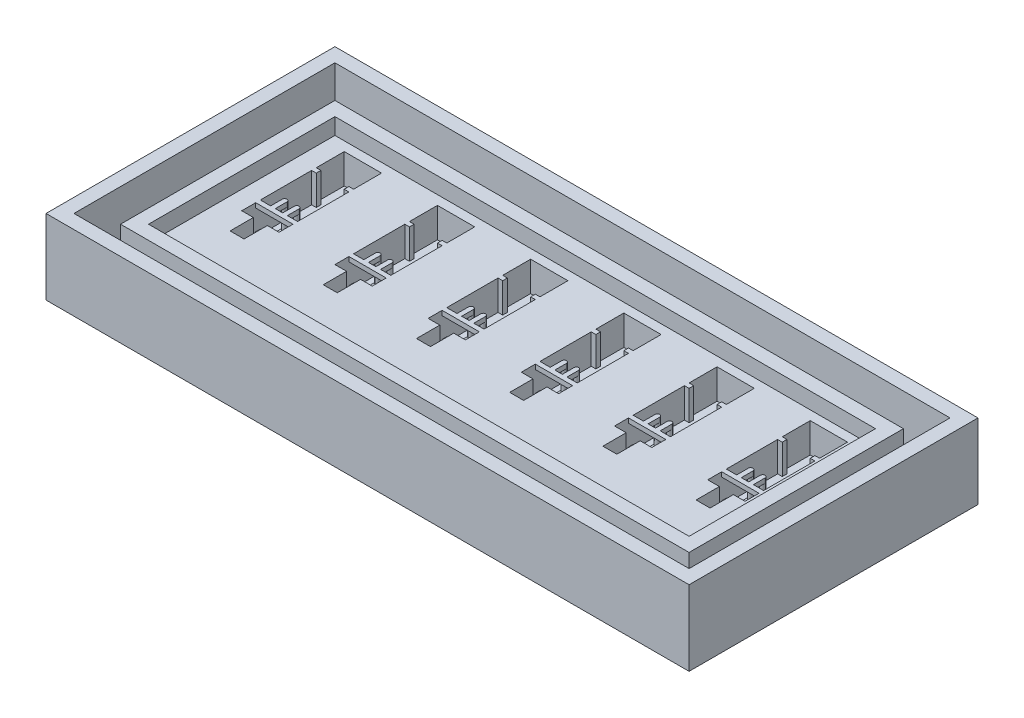
from build123d import *

# Parameters (mm, degrees)
SKETCH1_W            = 61
SKETCH1_H            = 23
BOSS_EXTRUDE1_DEPTH  = 6.05
SKETCH2_W            = 58
SKETCH2_H            = 20
CUT_EXTRUDE1_DEPTH   = 1.75
CUT_EXTRUDE3_DEPTH   = 3.2
SKETCH5_W            = 6
SKETCH5_H            = 1
CUT_EXTRUDE4_DEPTH   = 0.5
SKETCH10_W           = 4
SKETCH10_H           = 0.5
BOSS_EXTRUDE3_DEPTH  = 0.5
SKETCH11_W           = 4
SKETCH11_H           = 0.5
BOSS_EXTRUDE4_DEPTH  = 0.5
SKETCH9_R            = 0.25
SKETCH9_W            = 0.5
SKETCH9_H            = 1.25
BOSS_EXTRUDE5_DEPTH  = 0.5
BOSS_EXTRUDE6_START  = -0.5
BOSS_EXTRUDE6_DEPTH  = 0.5
BOSS_EXTRUDE7_REACH  = 34.898
SKETCH13_R           = 0.25
SKETCH14_W           = 69
SKETCH14_H           = 31
SKETCH14_W_2         = 66
SKETCH14_H_2         = 28
BOSS_EXTRUDE8_DEPTH  = 7.05
SKETCH15_W           = 69
SKETCH15_H           = 31
SKETCH15_W_2         = 66
SKETCH15_H_2         = 28
BOSS_EXTRUDE9_DEPTH  = 1
LPATTERN1_COUNT      = 2
LPATTERN1_PITCH      = 10
BOSS_EXTRUDE11_REACH = 40.191
SKETCH16_W           = 1
SKETCH16_H           = 1
BOSS_EXTRUDE12_REACH = 40.287
SKETCH18_W           = 4
SKETCH18_H           = 1
SKETCH19_W           = 61
SKETCH19_H           = 0.5
CUT_EXTRUDE5_DEPTH   = 23
SKETCH20_W           = 54
SKETCH20_H           = 7
BOSS_EXTRUDE13_DEPTH = 3.2
SKETCH21_W           = 1.5
SKETCH21_H           = 2.5
CUT_EXTRUDE6_DEPTH   = 3.2
BOSS_EXTRUDE14_REACH = 40.191
SKETCH22_W           = 0.5
SKETCH22_H           = 0.5
LPATTERN2_COUNT      = 6
LPATTERN2_PITCH      = 10
SKETCH23_W           = 4
SKETCH23_H           = 2.75
CUT_EXTRUDE7_DEPTH   = 3.2
BOSS_EXTRUDE15_DEPTH = 0.5
BOSS_EXTRUDE16_START = -0.5
BOSS_EXTRUDE16_DEPTH = 0.5
BOSS_EXTRUDE17_REACH = 40.213
SKETCH26_R           = 0.25
LPATTERN5_COUNT      = 6
LPATTERN5_PITCH      = 10


with BuildPart() as part:
    # Sketch1 → Boss-Extrude1 (new body)
    with BuildSketch(Plane(origin=(0, 0, 0), x_dir=(1, 0, 0), z_dir=(0, 1, 0))):
        Rectangle(SKETCH1_W, SKETCH1_H)
    extrude(amount=BOSS_EXTRUDE1_DEPTH)

    # Sketch2 → Cut-Extrude1 (cut)
    with BuildSketch(Plane(origin=(0, 6.05, 0), x_dir=(1, 0, 0), z_dir=(0, 1, 0))):
        Rectangle(SKETCH2_W, SKETCH2_H)
    extrude(amount=-CUT_EXTRUDE1_DEPTH, mode=Mode.SUBTRACT)

    # Sketch4 → Cut-Extrude3 (cut)
    with BuildSketch(Plane(origin=(0, 4.3, 0), x_dir=(1, 0, 0), z_dir=(0, 1, 0))):
        Polygon((-23, -0.5), (-22, -0.5), (-22, -1.5), (-23, -1.5), (-23, -9), (-27, -9), (-27, -1.5), (-28, -1.5), (-28, -0.5), (-27, -0.5), (-27, 9), (-23, 9), align=None)
        Polygon((-17, -9), (-13, -9), (-13, -1.5), (-12, -1.5), (-12, -0.5), (-13, -0.5), (-13, 9), (-17, 9), (-17, -0.5), (-18, -0.5), (-18, -1.5), (-17, -1.5), align=None)
        Polygon((-7, -9), (-3, -9), (-3, -1.5), (-2, -1.5), (-2, -0.5), (-3, -0.5), (-3, 9), (-7, 9), (-7, -0.5), (-8, -0.5), (-8, -1.5), (-7, -1.5), align=None)
        Polygon((3, -9), (7, -9), (7, -1.5), (8, -1.5), (8, -0.5), (7, -0.5), (7, 9), (3, 9), (3, -0.5), (2, -0.5), (2, -1.5), (3, -1.5), align=None)
        Polygon((13, -9), (17, -9), (17, -1.5), (18, -1.5), (18, -0.5), (17, -0.5), (17, 9), (13, 9), (13, -0.5), (12, -0.5), (12, -1.5), (13, -1.5), align=None)
        Polygon((23, -9), (27, -9), (27, -1.5), (28, -1.5), (28, -0.5), (27, -0.5), (27, 9), (23, 9), (23, -0.5), (22, -0.5), (22, -1.5), (23, -1.5), align=None)
    extrude(amount=-CUT_EXTRUDE3_DEPTH, mode=Mode.SUBTRACT)

    # Sketch5 → Cut-Extrude4 (cut)
    with BuildSketch(Plane(origin=(0, 1.1, 0), x_dir=(1, 0, 0), z_dir=(0, 1, 0))):
        with Locations((-25, -1)):
            Rectangle(SKETCH5_W, SKETCH5_H)
        with Locations((-15, -1)):
            Rectangle(SKETCH5_W, SKETCH5_H)
        with Locations((-5, -1)):
            Rectangle(SKETCH5_W, SKETCH5_H)
        with Locations((5, -1)):
            Rectangle(SKETCH5_W, SKETCH5_H)
        with Locations((15, -1)):
            Rectangle(SKETCH5_W, SKETCH5_H)
        with Locations((25, -1)):
            Rectangle(SKETCH5_W, SKETCH5_H)
    extrude(amount=-CUT_EXTRUDE4_DEPTH, mode=Mode.SUBTRACT)

    # Sketch10 → Boss-Extrude3 (add)
    with BuildSketch(Plane(origin=(0, 4.3, 0), x_dir=(1, 0, 0), z_dir=(0, 1, 0))):
        with Locations((-5, -0.25)):
            Rectangle(SKETCH10_W, SKETCH10_H)
        with Locations((25, -0.25)):
            Rectangle(SKETCH10_W, SKETCH10_H)
        with Locations((15, -0.25)):
            Rectangle(SKETCH10_W, SKETCH10_H)
        with Locations((5, -0.25)):
            Rectangle(SKETCH10_W, SKETCH10_H)
        with Locations((-15, -0.25)):
            Rectangle(SKETCH10_W, SKETCH10_H)
        with Locations((-25, -0.25)):
            Rectangle(SKETCH10_W, SKETCH10_H)
    extrude(amount=-BOSS_EXTRUDE3_DEPTH)

    # Sketch11 → Boss-Extrude4 (add)
    with BuildSketch(Plane(origin=(0, 1.1, 0), x_dir=(1, 0, 0), z_dir=(0, 1, 0))):
        with Locations((-5, -0.25)):
            Rectangle(SKETCH11_W, SKETCH11_H)
        with Locations((-25, -0.25)):
            Rectangle(SKETCH11_W, SKETCH11_H)
        with Locations((-15, -0.25)):
            Rectangle(SKETCH11_W, SKETCH11_H)
        with Locations((5, -0.25)):
            Rectangle(SKETCH11_W, SKETCH11_H)
        with Locations((15, -0.25)):
            Rectangle(SKETCH11_W, SKETCH11_H)
        with Locations((25, -0.25)):
            Rectangle(SKETCH11_W, SKETCH11_H)
    extrude(amount=BOSS_EXTRUDE4_DEPTH)

    # Sketch9 → Boss-Extrude5 (add)
    with BuildSketch(Plane(origin=(0, 1.1, 0), x_dir=(1, 0, 0), z_dir=(0, 1, 0))):
        with Locations((-4.35, 1.25)):
            Circle(SKETCH9_R)
        with Locations((-5.65, 1.25)):
            Circle(SKETCH9_R)
        with Locations((-25.5, 1.25)):
            Circle(SKETCH9_R)
        with Locations((-24.5, 1.25)):
            Circle(SKETCH9_R)
        with Locations((14.2, 1.25)):
            Circle(SKETCH9_R)
        with Locations((15.8, 1.25)):
            Circle(SKETCH9_R)
        with Locations((-5.65, 0.625)):
            Rectangle(SKETCH9_W, SKETCH9_H)
        with Locations((-25.5, 0.625)):
            Rectangle(SKETCH9_W, SKETCH9_H)
        with Locations((-4.35, 0.625)):
            Rectangle(SKETCH9_W, SKETCH9_H)
        with Locations((-24.5, 0.625)):
            Rectangle(SKETCH9_W, SKETCH9_H)
        with Locations((14.2, 0.625)):
            Rectangle(SKETCH9_W, SKETCH9_H)
        with Locations((15.8, 0.625)):
            Rectangle(SKETCH9_W, SKETCH9_H)
    boss_extrude5 = extrude(amount=BOSS_EXTRUDE5_DEPTH)

    # Sketch12 → Boss-Extrude6 (add)
    with BuildSketch(Plane(origin=(0, 4.3, 0), x_dir=(1, 0, 0), z_dir=(0, 1, 0)).offset(BOSS_EXTRUDE6_START)):
        with BuildLine():
            Line((-7, 0), (-7, -0.5))
            Line((-7, -0.5), (-3, -0.5))
            Line((-3, -0.5), (-3, 0))
            Line((-3, 0), (-4.1, 0))
            Line((-4.1, 0), (-4.1, 1.25))
            ThreePointArc((-4.1, 1.25), (-4.35, 1.5), (-4.6, 1.25))
            Line((-4.6, 1.25), (-4.6, 0))
            Line((-4.6, 0), (-5.4, 0))
            Line((-5.4, 0), (-5.4, 1.25))
            ThreePointArc((-5.4, 1.25), (-5.65, 1.5), (-5.9, 1.25))
            Line((-5.9, 1.25), (-5.9, 0))
            Line((-5.9, 0), (-7, 0))
        make_face()
        with BuildLine():
            Line((-27, 0), (-27, -0.5))
            Line((-27, -0.5), (-23, -0.5))
            Line((-23, -0.5), (-23, 0))
            Line((-23, 0), (-24.25, 0))
            Line((-24.25, 0), (-24.25, 1.25))
            ThreePointArc((-24.25, 1.25), (-24.5, 1.5), (-24.75, 1.25))
            Line((-24.75, 1.25), (-24.75, 0))
            Line((-24.75, 0), (-25.25, 0))
            Line((-25.25, 0), (-25.25, 1.25))
            ThreePointArc((-25.25, 1.25), (-25.5, 1.5), (-25.75, 1.25))
            Line((-25.75, 1.25), (-25.75, 0))
            Line((-25.75, 0), (-27, 0))
        make_face()
        with BuildLine():
            Line((13, 0), (13, -0.5))
            Line((13, -0.5), (17, -0.5))
            Line((17, -0.5), (17, 0))
            Line((17, 0), (16.05, 0))
            Line((16.05, 0), (16.05, 1.25))
            ThreePointArc((16.05, 1.25), (15.8, 1.5), (15.55, 1.25))
            Line((15.55, 1.25), (15.55, 0))
            Line((15.55, 0), (14.45, 0))
            Line((14.45, 0), (14.45, 1.25))
            ThreePointArc((14.45, 1.25), (14.2, 1.5), (13.95, 1.25))
            Line((13.95, 1.25), (13.95, 0))
            Line((13.95, 0), (13, 0))
        make_face()
    boss_extrude6 = extrude(amount=BOSS_EXTRUDE6_DEPTH)

    # Sketch13 → Boss-Extrude7 (add, up to next)
    with BuildSketch(Plane(origin=(0, 1.6, 0), x_dir=(1, 0, 0), z_dir=(0, 1, 0)), mode=Mode.PRIVATE) as boss_extrude7_sk1:
        with Locations(Location((-5.65, 1.25, 0), (0, 0, 180))):
            Circle(SKETCH13_R)
    boss_extrude7_tool1 = extrude(boss_extrude7_sk1.sketch, amount=BOSS_EXTRUDE7_REACH, mode=Mode.PRIVATE) - part.part
    # Sketch13 → Boss-Extrude7 (add, up to next)
    with BuildSketch(Plane(origin=(0, 1.6, 0), x_dir=(1, 0, 0), z_dir=(0, 1, 0)), mode=Mode.PRIVATE) as boss_extrude7_sk2:
        with Locations(Location((-4.35, 1.25, 0), (0, 0, 180))):
            Circle(SKETCH13_R)
    boss_extrude7_tool2 = extrude(boss_extrude7_sk2.sketch, amount=BOSS_EXTRUDE7_REACH, mode=Mode.PRIVATE) - part.part
    # Sketch13 → Boss-Extrude7 (add, up to next)
    with BuildSketch(Plane(origin=(0, 1.6, 0), x_dir=(1, 0, 0), z_dir=(0, 1, 0)), mode=Mode.PRIVATE) as boss_extrude7_sk3:
        with Locations(Location((-25.5, 1.25, 0), (0, 0, 180))):
            Circle(SKETCH13_R)
    boss_extrude7_tool3 = extrude(boss_extrude7_sk3.sketch, amount=BOSS_EXTRUDE7_REACH, mode=Mode.PRIVATE) - part.part
    # Sketch13 → Boss-Extrude7 (add, up to next)
    with BuildSketch(Plane(origin=(0, 1.6, 0), x_dir=(1, 0, 0), z_dir=(0, 1, 0)), mode=Mode.PRIVATE) as boss_extrude7_sk4:
        with Locations(Location((-24.5, 1.25, 0), (0, 0, 180))):
            Circle(SKETCH13_R)
    boss_extrude7_tool4 = extrude(boss_extrude7_sk4.sketch, amount=BOSS_EXTRUDE7_REACH, mode=Mode.PRIVATE) - part.part
    # Sketch13 → Boss-Extrude7 (add, up to next)
    with BuildSketch(Plane(origin=(0, 1.6, 0), x_dir=(1, 0, 0), z_dir=(0, 1, 0)), mode=Mode.PRIVATE) as boss_extrude7_sk5:
        with Locations(Location((14.2, 1.25, 0), (0, 0, 180))):
            Circle(SKETCH13_R)
    boss_extrude7_tool5 = extrude(boss_extrude7_sk5.sketch, amount=BOSS_EXTRUDE7_REACH, mode=Mode.PRIVATE) - part.part
    # Sketch13 → Boss-Extrude7 (add, up to next)
    with BuildSketch(Plane(origin=(0, 1.6, 0), x_dir=(1, 0, 0), z_dir=(0, 1, 0)), mode=Mode.PRIVATE) as boss_extrude7_sk6:
        with Locations(Location((15.8, 1.25, 0), (0, 0, 180))):
            Circle(SKETCH13_R)
    boss_extrude7_tool6 = extrude(boss_extrude7_sk6.sketch, amount=BOSS_EXTRUDE7_REACH, mode=Mode.PRIVATE) - part.part
    boss_extrude7_1 = boss_extrude7_tool1.solids().sort_by_distance((-5.65, 1.6, -1.25))[0]
    add(boss_extrude7_1)
    boss_extrude7_2 = boss_extrude7_tool2.solids().sort_by_distance((-4.35, 1.6, -1.25))[0]
    add(boss_extrude7_2)
    boss_extrude7_3 = boss_extrude7_tool3.solids().sort_by_distance((-25.5, 1.6, -1.25))[0]
    add(boss_extrude7_3)
    boss_extrude7_4 = boss_extrude7_tool4.solids().sort_by_distance((-24.5, 1.6, -1.25))[0]
    add(boss_extrude7_4)
    boss_extrude7_5 = boss_extrude7_tool5.solids().sort_by_distance((14.2, 1.6, -1.25))[0]
    add(boss_extrude7_5)
    boss_extrude7_6 = boss_extrude7_tool6.solids().sort_by_distance((15.8, 1.6, -1.25))[0]
    add(boss_extrude7_6)
    boss_extrude7 = boss_extrude7_1 + boss_extrude7_2 + boss_extrude7_3 + boss_extrude7_4 + boss_extrude7_5 + boss_extrude7_6  # Boss-Extrude7 as one shape, for the pattern or mirror that repeats it

    # LPattern1: Boss-Extrude5, Boss-Extrude6, Boss-Extrude7 ×2
    with Locations(*[(i * LPATTERN1_PITCH, 0, 0) for i in range(1, LPATTERN1_COUNT)]):
        add(boss_extrude5)
        add(boss_extrude6)
        add(boss_extrude7)

    # Sketch16 → Boss-Extrude11 (add, up to next)
    with BuildSketch(Plane(origin=(0, 4.3, 0), x_dir=(1, 0, 0), z_dir=(0, 1, 0)), mode=Mode.PRIVATE) as boss_extrude11_sk1:
        with Locations((-27.5, -1)):
            Rectangle(SKETCH16_W, SKETCH16_H)
    boss_extrude11_tool1 = extrude(boss_extrude11_sk1.sketch, amount=-BOSS_EXTRUDE11_REACH, mode=Mode.PRIVATE) - part.part
    # Sketch16 → Boss-Extrude11 (add, up to next)
    with BuildSketch(Plane(origin=(0, 4.3, 0), x_dir=(1, 0, 0), z_dir=(0, 1, 0)), mode=Mode.PRIVATE) as boss_extrude11_sk2:
        with Locations((-22.5, -1)):
            Rectangle(SKETCH16_W, SKETCH16_H)
    boss_extrude11_tool2 = extrude(boss_extrude11_sk2.sketch, amount=-BOSS_EXTRUDE11_REACH, mode=Mode.PRIVATE) - part.part
    # Sketch16 → Boss-Extrude11 (add, up to next)
    with BuildSketch(Plane(origin=(0, 4.3, 0), x_dir=(1, 0, 0), z_dir=(0, 1, 0)), mode=Mode.PRIVATE) as boss_extrude11_sk3:
        with Locations((-17.5, -1)):
            Rectangle(SKETCH16_W, SKETCH16_H)
    boss_extrude11_tool3 = extrude(boss_extrude11_sk3.sketch, amount=-BOSS_EXTRUDE11_REACH, mode=Mode.PRIVATE) - part.part
    # Sketch16 → Boss-Extrude11 (add, up to next)
    with BuildSketch(Plane(origin=(0, 4.3, 0), x_dir=(1, 0, 0), z_dir=(0, 1, 0)), mode=Mode.PRIVATE) as boss_extrude11_sk4:
        with Locations((-12.5, -1)):
            Rectangle(SKETCH16_W, SKETCH16_H)
    boss_extrude11_tool4 = extrude(boss_extrude11_sk4.sketch, amount=-BOSS_EXTRUDE11_REACH, mode=Mode.PRIVATE) - part.part
    # Sketch16 → Boss-Extrude11 (add, up to next)
    with BuildSketch(Plane(origin=(0, 4.3, 0), x_dir=(1, 0, 0), z_dir=(0, 1, 0)), mode=Mode.PRIVATE) as boss_extrude11_sk5:
        with Locations((-7.5, -1)):
            Rectangle(SKETCH16_W, SKETCH16_H)
    boss_extrude11_tool5 = extrude(boss_extrude11_sk5.sketch, amount=-BOSS_EXTRUDE11_REACH, mode=Mode.PRIVATE) - part.part
    # Sketch16 → Boss-Extrude11 (add, up to next)
    with BuildSketch(Plane(origin=(0, 4.3, 0), x_dir=(1, 0, 0), z_dir=(0, 1, 0)), mode=Mode.PRIVATE) as boss_extrude11_sk6:
        with Locations((-2.5, -1)):
            Rectangle(SKETCH16_W, SKETCH16_H)
    boss_extrude11_tool6 = extrude(boss_extrude11_sk6.sketch, amount=-BOSS_EXTRUDE11_REACH, mode=Mode.PRIVATE) - part.part
    # Sketch16 → Boss-Extrude11 (add, up to next)
    with BuildSketch(Plane(origin=(0, 4.3, 0), x_dir=(1, 0, 0), z_dir=(0, 1, 0)), mode=Mode.PRIVATE) as boss_extrude11_sk7:
        with Locations((2.5, -1)):
            Rectangle(SKETCH16_W, SKETCH16_H)
    boss_extrude11_tool7 = extrude(boss_extrude11_sk7.sketch, amount=-BOSS_EXTRUDE11_REACH, mode=Mode.PRIVATE) - part.part
    # Sketch16 → Boss-Extrude11 (add, up to next)
    with BuildSketch(Plane(origin=(0, 4.3, 0), x_dir=(1, 0, 0), z_dir=(0, 1, 0)), mode=Mode.PRIVATE) as boss_extrude11_sk8:
        with Locations((7.5, -1)):
            Rectangle(SKETCH16_W, SKETCH16_H)
    boss_extrude11_tool8 = extrude(boss_extrude11_sk8.sketch, amount=-BOSS_EXTRUDE11_REACH, mode=Mode.PRIVATE) - part.part
    # Sketch16 → Boss-Extrude11 (add, up to next)
    with BuildSketch(Plane(origin=(0, 4.3, 0), x_dir=(1, 0, 0), z_dir=(0, 1, 0)), mode=Mode.PRIVATE) as boss_extrude11_sk9:
        with Locations((12.5, -1)):
            Rectangle(SKETCH16_W, SKETCH16_H)
    boss_extrude11_tool9 = extrude(boss_extrude11_sk9.sketch, amount=-BOSS_EXTRUDE11_REACH, mode=Mode.PRIVATE) - part.part
    # Sketch16 → Boss-Extrude11 (add, up to next)
    with BuildSketch(Plane(origin=(0, 4.3, 0), x_dir=(1, 0, 0), z_dir=(0, 1, 0)), mode=Mode.PRIVATE) as boss_extrude11_sk10:
        with Locations((17.5, -1)):
            Rectangle(SKETCH16_W, SKETCH16_H)
    boss_extrude11_tool10 = extrude(boss_extrude11_sk10.sketch, amount=-BOSS_EXTRUDE11_REACH, mode=Mode.PRIVATE) - part.part
    # Sketch16 → Boss-Extrude11 (add, up to next)
    with BuildSketch(Plane(origin=(0, 4.3, 0), x_dir=(1, 0, 0), z_dir=(0, 1, 0)), mode=Mode.PRIVATE) as boss_extrude11_sk11:
        with Locations((22.5, -1)):
            Rectangle(SKETCH16_W, SKETCH16_H)
    boss_extrude11_tool11 = extrude(boss_extrude11_sk11.sketch, amount=-BOSS_EXTRUDE11_REACH, mode=Mode.PRIVATE) - part.part
    # Sketch16 → Boss-Extrude11 (add, up to next)
    with BuildSketch(Plane(origin=(0, 4.3, 0), x_dir=(1, 0, 0), z_dir=(0, 1, 0)), mode=Mode.PRIVATE) as boss_extrude11_sk12:
        with Locations((27.5, -1)):
            Rectangle(SKETCH16_W, SKETCH16_H)
    boss_extrude11_tool12 = extrude(boss_extrude11_sk12.sketch, amount=-BOSS_EXTRUDE11_REACH, mode=Mode.PRIVATE) - part.part
    add(boss_extrude11_tool1.solids().sort_by_distance((-27.5, 4.3, 1))[0])
    add(boss_extrude11_tool2.solids().sort_by_distance((-22.5, 4.3, 1))[0])
    add(boss_extrude11_tool3.solids().sort_by_distance((-17.5, 4.3, 1))[0])
    add(boss_extrude11_tool4.solids().sort_by_distance((-12.5, 4.3, 1))[0])
    add(boss_extrude11_tool5.solids().sort_by_distance((-7.5, 4.3, 1))[0])
    add(boss_extrude11_tool6.solids().sort_by_distance((-2.5, 4.3, 1))[0])
    add(boss_extrude11_tool7.solids().sort_by_distance((2.5, 4.3, 1))[0])
    add(boss_extrude11_tool8.solids().sort_by_distance((7.5, 4.3, 1))[0])
    add(boss_extrude11_tool9.solids().sort_by_distance((12.5, 4.3, 1))[0])
    add(boss_extrude11_tool10.solids().sort_by_distance((17.5, 4.3, 1))[0])
    add(boss_extrude11_tool11.solids().sort_by_distance((22.5, 4.3, 1))[0])
    add(boss_extrude11_tool12.solids().sort_by_distance((27.5, 4.3, 1))[0])

    # Sketch18 → Boss-Extrude12 (add, up to next)
    with BuildSketch(Plane(origin=(0, 1.1, 0), x_dir=(1, 0, 0), z_dir=(0, 1, 0)), mode=Mode.PRIVATE) as boss_extrude12_sk1:
        with Locations((-25, -1)):
            Rectangle(SKETCH18_W, SKETCH18_H)
    boss_extrude12_tool1 = extrude(boss_extrude12_sk1.sketch, amount=-BOSS_EXTRUDE12_REACH, mode=Mode.PRIVATE) - part.part
    # Sketch18 → Boss-Extrude12 (add, up to next)
    with BuildSketch(Plane(origin=(0, 1.1, 0), x_dir=(1, 0, 0), z_dir=(0, 1, 0)), mode=Mode.PRIVATE) as boss_extrude12_sk2:
        with Locations((-15, -1)):
            Rectangle(SKETCH18_W, SKETCH18_H)
    boss_extrude12_tool2 = extrude(boss_extrude12_sk2.sketch, amount=-BOSS_EXTRUDE12_REACH, mode=Mode.PRIVATE) - part.part
    # Sketch18 → Boss-Extrude12 (add, up to next)
    with BuildSketch(Plane(origin=(0, 1.1, 0), x_dir=(1, 0, 0), z_dir=(0, 1, 0)), mode=Mode.PRIVATE) as boss_extrude12_sk3:
        with Locations((-5, -1)):
            Rectangle(SKETCH18_W, SKETCH18_H)
    boss_extrude12_tool3 = extrude(boss_extrude12_sk3.sketch, amount=-BOSS_EXTRUDE12_REACH, mode=Mode.PRIVATE) - part.part
    # Sketch18 → Boss-Extrude12 (add, up to next)
    with BuildSketch(Plane(origin=(0, 1.1, 0), x_dir=(1, 0, 0), z_dir=(0, 1, 0)), mode=Mode.PRIVATE) as boss_extrude12_sk4:
        with Locations((5, -1)):
            Rectangle(SKETCH18_W, SKETCH18_H)
    boss_extrude12_tool4 = extrude(boss_extrude12_sk4.sketch, amount=-BOSS_EXTRUDE12_REACH, mode=Mode.PRIVATE) - part.part
    # Sketch18 → Boss-Extrude12 (add, up to next)
    with BuildSketch(Plane(origin=(0, 1.1, 0), x_dir=(1, 0, 0), z_dir=(0, 1, 0)), mode=Mode.PRIVATE) as boss_extrude12_sk5:
        with Locations((15, -1)):
            Rectangle(SKETCH18_W, SKETCH18_H)
    boss_extrude12_tool5 = extrude(boss_extrude12_sk5.sketch, amount=-BOSS_EXTRUDE12_REACH, mode=Mode.PRIVATE) - part.part
    # Sketch18 → Boss-Extrude12 (add, up to next)
    with BuildSketch(Plane(origin=(0, 1.1, 0), x_dir=(1, 0, 0), z_dir=(0, 1, 0)), mode=Mode.PRIVATE) as boss_extrude12_sk6:
        with Locations((25, -1)):
            Rectangle(SKETCH18_W, SKETCH18_H)
    boss_extrude12_tool6 = extrude(boss_extrude12_sk6.sketch, amount=-BOSS_EXTRUDE12_REACH, mode=Mode.PRIVATE) - part.part
    add(boss_extrude12_tool1.solids().sort_by_distance((-25, 1.1, 1))[0])
    add(boss_extrude12_tool2.solids().sort_by_distance((-15, 1.1, 1))[0])
    add(boss_extrude12_tool3.solids().sort_by_distance((-5, 1.1, 1))[0])
    add(boss_extrude12_tool4.solids().sort_by_distance((5, 1.1, 1))[0])
    add(boss_extrude12_tool5.solids().sort_by_distance((15, 1.1, 1))[0])
    add(boss_extrude12_tool6.solids().sort_by_distance((25, 1.1, 1))[0])

    # Sketch19 → Cut-Extrude5 (cut)
    with BuildSketch(Plane.XY.offset(11.5)):
        with Locations((0, 0.25)):
            Rectangle(SKETCH19_W, SKETCH19_H)
    extrude(amount=-CUT_EXTRUDE5_DEPTH, mode=Mode.SUBTRACT)

    # Sketch20 → Boss-Extrude13 (add)
    with BuildSketch(Plane(origin=(0, 4.3, 0), x_dir=(1, 0, 0), z_dir=(0, 1, 0))):
        with Locations((0, -5.5)):
            Rectangle(SKETCH20_W, SKETCH20_H)
    extrude(amount=-BOSS_EXTRUDE13_DEPTH)

    # Sketch21 → Cut-Extrude6 (cut)
    with BuildSketch(Plane(origin=(0, 4.3, 0), x_dir=(1, 0, 0), z_dir=(0, 1, 0))):
        with Locations((-25, -3.25)):
            Rectangle(SKETCH21_W, SKETCH21_H)
    cut_extrude6 = extrude(amount=-CUT_EXTRUDE6_DEPTH, mode=Mode.SUBTRACT)

    # Sketch22 → Boss-Extrude14 (add, up to next)
    with BuildSketch(Plane(origin=(0, 4.3, 0), x_dir=(1, 0, 0), z_dir=(0, 1, 0)), mode=Mode.PRIVATE) as boss_extrude14_sk1:
        with Locations((-26.75, 5.75)):
            Rectangle(SKETCH22_W, SKETCH22_H)
    boss_extrude14_tool1 = extrude(boss_extrude14_sk1.sketch, amount=-BOSS_EXTRUDE14_REACH, mode=Mode.PRIVATE) - part.part
    # Sketch22 → Boss-Extrude14 (add, up to next)
    with BuildSketch(Plane(origin=(0, 4.3, 0), x_dir=(1, 0, 0), z_dir=(0, 1, 0)), mode=Mode.PRIVATE) as boss_extrude14_sk2:
        with Locations((-23.25, 5.75)):
            Rectangle(SKETCH22_W, SKETCH22_H)
    boss_extrude14_tool2 = extrude(boss_extrude14_sk2.sketch, amount=-BOSS_EXTRUDE14_REACH, mode=Mode.PRIVATE) - part.part
    boss_extrude14_1 = boss_extrude14_tool1.solids().sort_by_distance((-26.75, 4.3, -5.75))[0]
    add(boss_extrude14_1)
    boss_extrude14_2 = boss_extrude14_tool2.solids().sort_by_distance((-23.25, 4.3, -5.75))[0]
    add(boss_extrude14_2)
    boss_extrude14 = boss_extrude14_1 + boss_extrude14_2  # Boss-Extrude14 as one shape, for the pattern or mirror that repeats it

    # LPattern2: Cut-Extrude6, Boss-Extrude14 ×6
    with Locations(*[(i * LPATTERN2_PITCH, 0, 0) for i in range(1, LPATTERN2_COUNT)]):
        add(cut_extrude6, mode=Mode.SUBTRACT)
        add(boss_extrude14)

    # Sketch23 → Cut-Extrude7 (cut)
    with BuildSketch(Plane(origin=(0, 4.3, 0), x_dir=(1, 0, 0), z_dir=(0, 1, 0))):
        with Locations((-15, 1.375)):
            Rectangle(SKETCH23_W, SKETCH23_H)
        with Locations((-25, 1.375)):
            Rectangle(SKETCH23_W, SKETCH23_H)
        with Locations((15, 1.375)):
            Rectangle(SKETCH23_W, SKETCH23_H)
        with Locations((25, 1.375)):
            Rectangle(SKETCH23_W, SKETCH23_H)
    extrude(amount=-CUT_EXTRUDE7_DEPTH, mode=Mode.SUBTRACT)

    # Sketch24 → Boss-Extrude15 (add)
    with BuildSketch(Plane(origin=(0, 1.1, 0), x_dir=(1, 0, 0), z_dir=(0, 1, 0))):
        with BuildLine():
            Line((-24.6, 1.25), (-24.6, 0))
            Line((-24.6, 0), (-24.1, 0))
            Line((-24.1, 0), (-24.1, 1.25))
            ThreePointArc((-24.1, 1.25), (-24.35, 1), (-24.6, 1.25))
        make_face()
        with BuildLine():
            ThreePointArc((-24.1, 1.25), (-24.35, 1.5), (-24.6, 1.25))
            Line((-24.6, 1.25), (-24.1, 1.25))
        make_face()
        with BuildLine():
            Line((-24.1, 1.25), (-24.6, 1.25))
            ThreePointArc((-24.6, 1.25), (-24.35, 1), (-24.1, 1.25))
        make_face()
        with BuildLine():
            ThreePointArc((-24.1, 1.25), (-24.35, 1.5), (-24.6, 1.25))
            Line((-24.6, 1.25), (-24.1, 1.25))
        make_face()
        with BuildLine():
            Line((-24.1, 1.25), (-24.6, 1.25))
            ThreePointArc((-24.6, 1.25), (-24.35, 1), (-24.1, 1.25))
        make_face()
        with BuildLine():
            ThreePointArc((-25.4, 1.25), (-25.65, 1.5), (-25.9, 1.25))
            Line((-25.9, 1.25), (-25.4, 1.25))
        make_face()
        with BuildLine():
            Line((-25.4, 1.25), (-25.9, 1.25))
            ThreePointArc((-25.9, 1.25), (-25.65, 1), (-25.4, 1.25))
        make_face()
        with BuildLine():
            ThreePointArc((-25.4, 1.25), (-25.65, 1.5), (-25.9, 1.25))
            Line((-25.9, 1.25), (-25.4, 1.25))
        make_face()
        with BuildLine():
            Line((-25.4, 1.25), (-25.9, 1.25))
            ThreePointArc((-25.9, 1.25), (-25.65, 1), (-25.4, 1.25))
        make_face()
        with BuildLine():
            Line((-25.9, 1.25), (-25.9, 0))
            Line((-25.9, 0), (-25.4, 0))
            Line((-25.4, 0), (-25.4, 1.25))
            ThreePointArc((-25.4, 1.25), (-25.65, 1), (-25.9, 1.25))
        make_face()
    boss_extrude15 = extrude(amount=BOSS_EXTRUDE15_DEPTH)

    # Sketch25 → Boss-Extrude16 (add)
    with BuildSketch(Plane(origin=(0, 4.3, 0), x_dir=(1, 0, 0), z_dir=(0, 1, 0)).offset(BOSS_EXTRUDE16_START)):
        with BuildLine():
            Line((-25.9, 1.25), (-25.9, 0))
            Line((-25.9, 0), (-25.4, 0))
            Line((-25.4, 0), (-25.4, 1.25))
            ThreePointArc((-25.4, 1.25), (-25.65, 1), (-25.9, 1.25))
        make_face()
        with BuildLine():
            ThreePointArc((-25.4, 1.25), (-25.65, 1.5), (-25.9, 1.25))
            Line((-25.9, 1.25), (-25.4, 1.25))
        make_face()
        with BuildLine():
            Line((-25.4, 1.25), (-25.9, 1.25))
            ThreePointArc((-25.9, 1.25), (-25.65, 1), (-25.4, 1.25))
        make_face()
        with BuildLine():
            ThreePointArc((-25.4, 1.25), (-25.65, 1.5), (-25.9, 1.25))
            Line((-25.9, 1.25), (-25.4, 1.25))
        make_face()
        with BuildLine():
            Line((-25.4, 1.25), (-25.9, 1.25))
            ThreePointArc((-25.9, 1.25), (-25.65, 1), (-25.4, 1.25))
        make_face()
        with BuildLine():
            ThreePointArc((-24.1, 1.25), (-24.35, 1.5), (-24.6, 1.25))
            Line((-24.6, 1.25), (-24.1, 1.25))
        make_face()
        with BuildLine():
            Line((-24.1, 1.25), (-24.6, 1.25))
            ThreePointArc((-24.6, 1.25), (-24.35, 1), (-24.1, 1.25))
        make_face()
        with BuildLine():
            ThreePointArc((-24.1, 1.25), (-24.35, 1.5), (-24.6, 1.25))
            Line((-24.6, 1.25), (-24.1, 1.25))
        make_face()
        with BuildLine():
            Line((-24.1, 1.25), (-24.6, 1.25))
            ThreePointArc((-24.6, 1.25), (-24.35, 1), (-24.1, 1.25))
        make_face()
        with BuildLine():
            Line((-24.6, 1.25), (-24.6, 0))
            Line((-24.6, 0), (-24.1, 0))
            Line((-24.1, 0), (-24.1, 1.25))
            ThreePointArc((-24.1, 1.25), (-24.35, 1), (-24.6, 1.25))
        make_face()
    boss_extrude16 = extrude(amount=BOSS_EXTRUDE16_DEPTH)

    # Sketch26 → Boss-Extrude17 (add, up to next)
    with BuildSketch(Plane(origin=(0, 1.6, 0), x_dir=(1, 0, 0), z_dir=(0, 1, 0)), mode=Mode.PRIVATE) as boss_extrude17_sk1:
        with Locations((-25.65, 1.25)):
            Circle(SKETCH26_R)
    boss_extrude17_tool1 = extrude(boss_extrude17_sk1.sketch, amount=BOSS_EXTRUDE17_REACH, mode=Mode.PRIVATE) - part.part
    # Sketch26 → Boss-Extrude17 (add, up to next)
    with BuildSketch(Plane(origin=(0, 1.6, 0), x_dir=(1, 0, 0), z_dir=(0, 1, 0)), mode=Mode.PRIVATE) as boss_extrude17_sk2:
        with Locations(Location((-24.35, 1.25, 0), (0, 0, 180))):
            Circle(SKETCH26_R)
    boss_extrude17_tool2 = extrude(boss_extrude17_sk2.sketch, amount=BOSS_EXTRUDE17_REACH, mode=Mode.PRIVATE) - part.part
    boss_extrude17_1 = boss_extrude17_tool1.solids().sort_by_distance((-25.65, 1.6, -1.25))[0]
    add(boss_extrude17_1)
    boss_extrude17_2 = boss_extrude17_tool2.solids().sort_by_distance((-24.35, 1.6, -1.25))[0]
    add(boss_extrude17_2)
    boss_extrude17 = boss_extrude17_1 + boss_extrude17_2  # Boss-Extrude17 as one shape, for the pattern or mirror that repeats it

    # LPattern5: Boss-Extrude15, Boss-Extrude16, Boss-Extrude17 ×6
    with Locations(*[(i * LPATTERN5_PITCH, 0, 0) for i in range(1, LPATTERN5_COUNT)]):
        add(boss_extrude15)
        add(boss_extrude16)
        add(boss_extrude17)


with BuildPart() as body_2:
    # Sketch14 → Boss-Extrude8 (new body)
    with BuildSketch(Plane.XZ):
        Rectangle(SKETCH14_W, SKETCH14_H)
        Rectangle(SKETCH14_W_2, SKETCH14_H_2, mode=Mode.SUBTRACT)
    extrude(amount=-BOSS_EXTRUDE8_DEPTH)

    # Sketch15 → Boss-Extrude9 (add)
    with BuildSketch(Plane.XZ):
        Rectangle(SKETCH15_W, SKETCH15_H)
        Rectangle(SKETCH15_W_2, SKETCH15_H_2, mode=Mode.SUBTRACT)
    extrude(amount=BOSS_EXTRUDE9_DEPTH)


solid = Compound([part.part, body_2.part])
